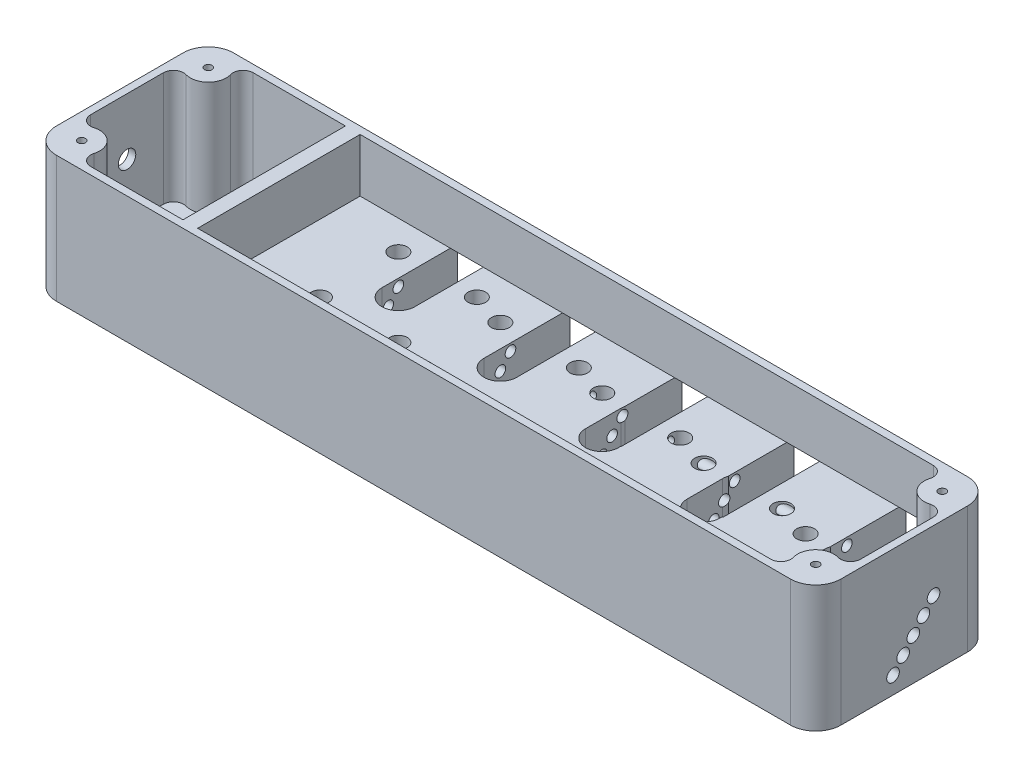
from build123d import *

# Parameters (mm, degrees)
BOSS_EXTRUDE2_DEPTH                = 50
SHELL2_T                           = -2.9
BOSS_EXTRUDE4_DEPTH                = 26
M6X1_0_TAPPED_HOLE1_D              = 5
M6X1_0_TAPPED_HOLE1_DEPTH          = 6
M6X1_0_TAPPED_HOLE1_TIP            = 1.5021515475689007
CUT_EXTRUDE2_DEPTH                 = 24
F_12_0MM_DOWEL_HOLE1_D             = 12
SKETCH20_W                         = 13.000000000000021
SKETCH20_H                         = 24
CUT_EXTRUDE3_DEPTH                 = 28.999999999999996
SKETCH20_4_W                       = 13.00000000000001
SKETCH20_4_H                       = 24
CUT_EXTRUDE4_DEPTH                 = 33
SKETCH20_5_W                       = 13
SKETCH20_5_H                       = 24
CUT_EXTRUDE5_DEPTH                 = 37
SKETCH20_6_W                       = 13
SKETCH20_6_H                       = 24
CUT_EXTRUDE6_DEPTH                 = 41
SKETCH20_7_W                       = 13.000000000000043
SKETCH20_7_H                       = 24.000000000000004
CUT_EXTRUDE7_DEPTH                 = 45
BOSS_EXTRUDE5_DEPTH                = 50
FILLET1_R                          = 10
CUT_EXTRUDE8_DEPTH                 = 45
F_4_2_START                        = -92.9
F_4_2_4_2_DIAMETER_HOLE1_OUTLINE_R = 2.1
F_4_2_4_2_DIAMETER_HOLE1_DEPTH     = 246.659655852
F_5_16_24_TAPPED_HOLE1_REACH       = 315.179
F_5_16_24_TAPPED_HOLE1_BORE_R      = 3.4544
SKETCH37_R                         = 7.1000000000000085
BOSS_EXTRUDE6_DEPTH                = 21.1
BOSS_EXTRUDE7_START                = 45
SKETCH38_R                         = 7.100000000000008
BOSS_EXTRUDE7_DEPTH                = 45
HOLE1_D                            = 3
HOLE1_CBORE_D                      = 7
HOLE1_CBORE_DEPTH                  = 40
FILLET2_R                          = 4
F_3_0MM_DOWEL_HOLE1_D              = 3
F_3_0MM_DOWEL_HOLE1_DEPTH          = 10
F_3_0MM_DOWEL_HOLE1_TIP            = 0.9012909285413404
HOLE2_D                            = 3
HOLE2_CBORE_D                      = 7
HOLE2_CBORE_DEPTH                  = 25


# Read off the part's stored shape, not the designer's step: Ø4.2 (4.2) Diameter Hole1
# Some blends are built 0.0001 mm under size
with BuildPart() as part:
    # Sketch1 → Boss-Extrude2 (new body)
    with BuildSketch(Plane(origin=(0, 0, 0), x_dir=(1, 0, 0), z_dir=(0, 1, 0))):
        with BuildLine():
            Line((-89.99999999999999, -25), (-89.99999999999999, -35))
            Line((-89.99999999999999, -35), (-79.99999999999999, -35))
            Line((-79.99999999999999, -35), (150.00000000000003, -35))
            ThreePointArc((150.00000000000003, -35), (157.0710678118655, -32.071067811865476), (160.00000000000003, -25))
            Line((160.00000000000003, -25), (160.00000000000003, 25))
            ThreePointArc((160.00000000000003, 25), (157.0710678118655, 32.071067811865476), (150.00000000000003, 35.00000000000001))
            Line((150.00000000000003, 35.00000000000001), (-79.99999999999999, 35.00000000000001))
            Line((-79.99999999999999, 35.00000000000001), (-89.99999999999999, 35.00000000000001))
            Line((-89.99999999999999, 35.00000000000001), (-89.99999999999999, 25))
            Line((-89.99999999999999, 25), (-89.99999999999999, -25))
        make_face()
    extrude(amount=BOSS_EXTRUDE2_DEPTH)

    # Shell2
    shell2_openings = [part.faces().sort_by_distance(p)[0] for p in [
        (34.698163972, 50, 0),
    ]]
    offset(amount=SHELL2_T, openings=shell2_openings, kind=Kind.INTERSECTION)

    # Sketch11 → Boss-Extrude4 (add)
    with BuildSketch(Plane(origin=(0, 2.9, 0), x_dir=(1, 0, 0), z_dir=(0, 1, 0))):
        with BuildLine():
            Line((-87.09999999999998, -32.1), (150.00000000000003, -32.1))
            ThreePointArc((150.00000000000003, -32.1), (155.02045814642452, -30.020458146424488), (157.10000000000002, -25))
            Line((157.10000000000002, -25), (157.10000000000002, 25))
            ThreePointArc((157.10000000000002, 25), (155.02045814642452, 30.02045814642448), (150.00000000000003, 32.1))
            Line((150.00000000000003, 32.1), (-87.09999999999998, 32.10000000000001))
            Line((-87.09999999999998, 32.10000000000001), (-87.09999999999998, -32.1))
        make_face()
    extrude(amount=BOSS_EXTRUDE4_DEPTH)

    # M6x1.0 Tapped Hole1
    with Locations(Plane(origin=(160, 6.8, 4.45), x_dir=(0, 0, 1), z_dir=(1, 0, 0))):
        with Locations((0, 0), (-4, -4.8), (-8, -9.6), (-12, -14.4), (-16, -19.2)):
            Hole(M6X1_0_TAPPED_HOLE1_D / 2, depth=M6X1_0_TAPPED_HOLE1_DEPTH)
            with Locations((0, 0, -(M6X1_0_TAPPED_HOLE1_DEPTH + M6X1_0_TAPPED_HOLE1_TIP / 2))):  # 118° drill point
                Cone(0, M6X1_0_TAPPED_HOLE1_D / 2, M6X1_0_TAPPED_HOLE1_TIP, mode=Mode.SUBTRACT)

    # Sketch15 → Cut-Extrude2 (cut)
    with BuildSketch(Plane(origin=(0, 28.9, 0), x_dir=(1, 0, 0), z_dir=(0, 1, 0))):
        with BuildLine():
            Line((125.45, -10.950000000000005), (125.45, 3.0499999999999954))
            ThreePointArc((125.45, 3.0499999999999954), (131.95000000000002, 9.549999999999995), (138.45000000000002, 3.0499999999999954))
            Line((138.45000000000002, 3.0499999999999954), (138.45000000000002, -10.950000000000005))
            ThreePointArc((138.45000000000002, -10.950000000000005), (131.95000000000002, -17.450000000000017), (125.45, -10.950000000000005))
        make_face()
        with BuildLine():
            Line((81.15, -6.950000000000005), (81.15, 7.049999999999995))
            ThreePointArc((81.15, 7.049999999999995), (87.65, 13.549999999999995), (94.15, 7.049999999999995))
            Line((94.15, 7.049999999999995), (94.15, -6.950000000000005))
            ThreePointArc((94.15, -6.950000000000005), (87.65, -13.450000000000005), (81.15, -6.950000000000005))
        make_face()
        with BuildLine():
            Line((36.99999999999999, -2.9500000000000046), (36.99999999999999, 11.049999999999994))
            ThreePointArc((36.99999999999999, 11.049999999999994), (43.5, 17.549999999999994), (50, 11.049999999999994))
            Line((50, 11.049999999999994), (50, -2.9500000000000046))
            ThreePointArc((50, -2.9500000000000046), (43.5, -9.450000000000012), (36.99999999999999, -2.9500000000000046))
        make_face()
        with BuildLine():
            Line((-7.150000000000004, 1.0500000000000023), (-7.150000000000004, 15.05))
            ThreePointArc((-7.150000000000004, 15.05), (-0.6499999999999974, 21.550000000000004), (5.850000000000008, 15.05))
            Line((5.850000000000008, 15.05), (5.850000000000008, 1.0500000000000023))
            ThreePointArc((5.850000000000008, 1.0500000000000023), (-0.649999999999999, -5.450000000000004), (-7.150000000000004, 1.0500000000000023))
        make_face()
        with BuildLine():
            Line((-51.45000000000001, 5.049999999999995), (-51.45000000000001, 19.05))
            ThreePointArc((-51.45000000000001, 19.05), (-44.95, 25.550000000000008), (-38.449999999999996, 19.05))
            Line((-38.449999999999996, 19.05), (-38.449999999999996, 5.049999999999995))
            ThreePointArc((-38.449999999999996, 5.049999999999995), (-44.95, -1.4500000000000117), (-51.45000000000001, 5.049999999999995))
        make_face()
    extrude(amount=-CUT_EXTRUDE2_DEPTH, mode=Mode.SUBTRACT)

    # Ø12.0mm Dowel Hole1 (through all)
    with Locations(Plane(origin=(-44.95, 0, -5.05), x_dir=(0, 0, -1), z_dir=(0, -1, 0))):
        with Locations((0, 0), (-4, 44.3), (-8, 88.45), (-12, 132.6), (-16, 176.9)):
            Hole(F_12_0MM_DOWEL_HOLE1_D / 2)

    # Sketch20 → Cut-Extrude3 (cut)
    with BuildSketch(Plane(origin=(0, 0, -35.00000000000001), x_dir=(-1, 0, 0), z_dir=(0, 0, -1))):
        with Locations((44.95, 16.9)):
            Rectangle(SKETCH20_W, SKETCH20_H)
    extrude(amount=-CUT_EXTRUDE3_DEPTH, mode=Mode.SUBTRACT)

    # Sketch20<4> → Cut-Extrude4 (cut)
    with BuildSketch(Plane(origin=(0, 0, -35.00000000000001), x_dir=(-1, 0, 0), z_dir=(0, 0, -1))):
        with Locations((0.6500000000000257, 16.9)):
            Rectangle(SKETCH20_4_W, SKETCH20_4_H)
    extrude(amount=-CUT_EXTRUDE4_DEPTH, mode=Mode.SUBTRACT)

    # Sketch20<5> → Cut-Extrude5 (cut)
    with BuildSketch(Plane(origin=(0, 0, -35.00000000000001), x_dir=(-1, 0, 0), z_dir=(0, 0, -1))):
        with Locations((-43.64999999999995, 16.900000000000002)):
            Rectangle(SKETCH20_5_W, SKETCH20_5_H)
    extrude(amount=-CUT_EXTRUDE5_DEPTH, mode=Mode.SUBTRACT)

    # Sketch20<6> → Cut-Extrude6 (cut)
    with BuildSketch(Plane(origin=(0, 0, -35.00000000000001), x_dir=(-1, 0, 0), z_dir=(0, 0, -1))):
        with Locations((-87.94999999999993, 16.900000000000002)):
            Rectangle(SKETCH20_6_W, SKETCH20_6_H)
    extrude(amount=-CUT_EXTRUDE6_DEPTH, mode=Mode.SUBTRACT)

    # Sketch20<7> → Cut-Extrude7 (cut)
    with BuildSketch(Plane(origin=(0, 0, -35.00000000000001), x_dir=(-1, 0, 0), z_dir=(0, 0, -1))):
        with Locations((-132.24999999999991, 16.900000000000006)):
            Rectangle(SKETCH20_7_W, SKETCH20_7_H)
    extrude(amount=-CUT_EXTRUDE7_DEPTH, mode=Mode.SUBTRACT)

    # Sketch26 → Boss-Extrude5 (add)
    with BuildSketch(Plane.XZ):
        Polygon((-149.99999999999997, 34.99999999999995), (-149.99999999999997, -35.00000000000001), (-89.99999999999999, -35.00000000000001), (-89.99999999999999, 35), align=None)
    extrude(amount=-BOSS_EXTRUDE5_DEPTH)

    # Fillet1
    fillet1_edges = [part.edges().sort_by_distance(p)[0] for p in [
        (-149.99999999999997, 25, 34.99999999999995),
        (-149.99999999999997, 25, -35.00000000000001),
    ]]
    fillet(fillet1_edges, radius=FILLET1_R)

    # Sketch28 → Cut-Extrude8 (cut)
    with BuildSketch(Plane(origin=(0, 50, 0), x_dir=(1, 0, 0), z_dir=(0, 1, 0))):
        with BuildLine():
            Line((-92.89999999999998, -32.1), (-139.99999999999997, -32.10000000000001))
            ThreePointArc((-139.99999999999997, -32.10000000000001), (-145.02045814642446, -30.02045814642448), (-147.09999999999997, -25))
            Line((-147.09999999999997, -25), (-147.09999999999997, 25.000000000000007))
            ThreePointArc((-147.09999999999997, 25.000000000000007), (-145.02045814642446, 30.020458146424502), (-139.99999999999997, 32.100000000000016))
            Line((-139.99999999999997, 32.100000000000016), (-92.89999999999998, 32.100000000000016))
            Line((-92.89999999999998, 32.100000000000016), (-92.89999999999998, -32.1))
        make_face()
    extrude(amount=-CUT_EXTRUDE8_DEPTH, mode=Mode.SUBTRACT)

    # Ø4.2 (4.2) Diameter Hole1 outline → Ø4.2 (4.2) Diameter Hole1 (cut)
    with BuildSketch(Plane.YZ.offset(F_4_2_START)):
        with Locations((26, -11.55)):
            Circle(F_4_2_4_2_DIAMETER_HOLE1_OUTLINE_R)
        with Locations((21.2, -7.55)):
            Circle(F_4_2_4_2_DIAMETER_HOLE1_OUTLINE_R)
        with Locations((16.4, -3.55)):
            Circle(F_4_2_4_2_DIAMETER_HOLE1_OUTLINE_R)
        with Locations((11.6, 0.45)):
            Circle(F_4_2_4_2_DIAMETER_HOLE1_OUTLINE_R)
        with Locations((6.8, 4.45)):
            Circle(F_4_2_4_2_DIAMETER_HOLE1_OUTLINE_R)
    extrude(amount=F_4_2_4_2_DIAMETER_HOLE1_DEPTH, mode=Mode.SUBTRACT)

    # 5/16-24 Tapped Hole1 bore (on position points) → 5/16-24 Tapped Hole1 (cut, up to next)
    with BuildSketch(Plane(origin=(-150, 27.5, 0), x_dir=(0, 0, -1), z_dir=(-1, 0, 0)), mode=Mode.PRIVATE) as f_5_16_24_tapped_hole1_sk1:
        Circle(F_5_16_24_TAPPED_HOLE1_BORE_R)
    f_5_16_24_tapped_hole1_tool1 = extrude(f_5_16_24_tapped_hole1_sk1.sketch, amount=-F_5_16_24_TAPPED_HOLE1_REACH, mode=Mode.PRIVATE) & part.part
    add(f_5_16_24_tapped_hole1_tool1.solids().sort_by_distance((-150, 27.5, 0))[0], mode=Mode.SUBTRACT)

    # Sketch37 → Boss-Extrude6 (add)
    with BuildSketch(Plane(origin=(0, 28.9, 0), x_dir=(1, 0, 0), z_dir=(0, 1, 0))):
        with Locations((150.00000000000003, 25)):
            Circle(SKETCH37_R)
        with Locations((150.00000000000003, -25)):
            Circle(SKETCH37_R)
    extrude(amount=BOSS_EXTRUDE6_DEPTH)

    # Sketch38 → Boss-Extrude7 (add)
    with BuildSketch(Plane(origin=(0, 5, 0), x_dir=(1, 0, 0), z_dir=(0, 1, 0)).offset(BOSS_EXTRUDE7_START)):
        with Locations((-139.99999999999997, -25)):
            Circle(SKETCH38_R)
        with Locations((-139.99999999999997, 25.000000000000007)):
            Circle(SKETCH38_R)
    extrude(amount=-BOSS_EXTRUDE7_DEPTH)

    # Hole1 (through all)
    with Locations(Plane(origin=(150, 0, -25), x_dir=(0, 0, -1), z_dir=(0, -1, 0))):
        with Locations((0, 0), (-50, 0), (0, -290), (-50, -290)):
            CounterBoreHole(HOLE1_D / 2, HOLE1_CBORE_D / 2, HOLE1_CBORE_DEPTH)

    # Fillet2
    fillet2_edges = [part.edges().sort_by_distance(p)[0] for p in [
        (-139.99999999999997, 27.5, -32.100000000000016),
    ]]
    fillet(fillet2_edges, radius=FILLET2_R)
    fillet2_2_edges = [part.edges().sort_by_distance(p)[0] for p in [
        (-147.09999999999997, 27.5, -25.000000000000007),
    ]]
    fillet(fillet2_2_edges, radius=FILLET2_R)
    fillet2_3_edges = [part.edges().sort_by_distance(p)[0] for p in [
        (-147.09999999999997, 27.5, 25),
    ]]
    fillet(fillet2_3_edges, radius=FILLET2_R)
    fillet2_4_edges = [part.edges().sort_by_distance(p)[0] for p in [
        (157.10000000000002, 39.45, 25),
    ]]
    fillet(fillet2_4_edges, radius=FILLET2_R)
    fillet2_5_edges = [part.edges().sort_by_distance(p)[0] for p in [
        (157.10000000000002, 39.45, -25),
    ]]
    fillet(fillet2_5_edges, radius=FILLET2_R - 0.0004)  # a hair under: the kernel refuses the full size
    fillet2_6_edges = [part.edges().sort_by_distance(p)[0] for p in [
        (150.00000000000003, 39.45, -32.1),
    ]]
    fillet(fillet2_6_edges, radius=FILLET2_R)
    fillet2_7_edges = [part.edges().sort_by_distance(p)[0] for p in [
        (-139.99999999999997, 27.5, 32.10000000000001),
    ]]
    fillet(fillet2_7_edges, radius=FILLET2_R)
    # the kernel refuses this fillet: 4 mm, written as the material it adds along each edge
    with BuildSketch(Plane(origin=(150, 2.2541748110442157, 32.1), x_dir=(-1, 0, 0), z_dir=(0, 1, 0))) as fillet2_8_piece_1:
        with BuildLine():
            CenterArc((10.658330075582285, -4), FILLET2_R, 90, 106.21719456321253)
            Line((6.81749040870676, -5.117117117116841), (6.740673615369246, -5.139459459459179))
            ThreePointArc((6.740673615369246, -5.139459459459179), (4.21410758081845, -1.4855813037066419), (0, -0.0799999999999983))
            Line((0, -0.0799999999999983), (0, 0.0799999999999983))
            Line((0, 0.0799999999999983), (10.658330075582285, 0.0799999999999983))
            Line((10.658330075582285, 0.0799999999999983), (10.658330075582285, 0))
        make_face()
    extrude(amount=47.745825188955784)

    # Ø3.0mm Dowel Hole1
    with Locations(Plane(origin=(132.25, 0, -27), x_dir=(0, 0, -1), z_dir=(0, -1, 0))):
        with Locations((0, 0), (0, -44.3), (0, -88.6), (0, -132.9), (0, -177.2)):
            Hole(F_3_0MM_DOWEL_HOLE1_D / 2, depth=F_3_0MM_DOWEL_HOLE1_DEPTH)
            with Locations((0, 0, -(F_3_0MM_DOWEL_HOLE1_DEPTH + F_3_0MM_DOWEL_HOLE1_TIP / 2))):  # 118° drill point
                Cone(0, F_3_0MM_DOWEL_HOLE1_D / 2, F_3_0MM_DOWEL_HOLE1_TIP, mode=Mode.SUBTRACT)

    # Hole2 (through all)
    with Locations(Plane(origin=(103.15, 28.9, 22.45), x_dir=(0, 0, 1), z_dir=(0, 1, 0))):
        with Locations((0, 0), (0, -31), (-31, 0), (-31, -31), (4, 13.3), (-27, 13.3), (-27, 44.3), (-3.889285714, -44.15), (-3.889285714, -75.15), (-35, -75.040070922), (-35, -44.259929078), (-8, -88.3), (-8, -119.3), (-39, -119.3), (-39, -88.3), (-12, -132.6), (-12, -163.6), (-43, -163.6), (-43, -132.6)):
            CounterBoreHole(HOLE2_D / 2, HOLE2_CBORE_D / 2, HOLE2_CBORE_DEPTH)


solid = part.part
